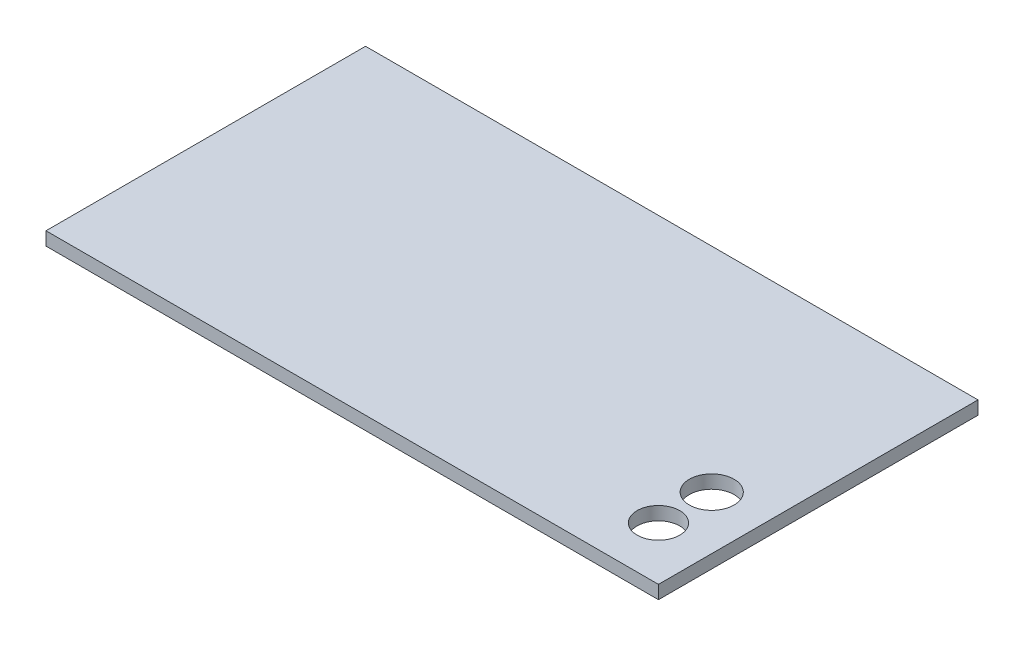
from build123d import *

# Parameters (mm, degrees)
SKETCH1_W           = 146.05
SKETCH1_H           = 76.2
SKETCH1_R           = 5.08
SKETCH1_R_2         = 5.334
BOSS_EXTRUDE1_DEPTH = 3.175


with BuildPart() as part:
    # Sketch1 → Boss-Extrude1 (new body)
    with BuildSketch(Plane(origin=(0, 0, 0), x_dir=(1, 0, 0), z_dir=(0, 1, 0))):
        with Locations((73.025, 38.1)):
            Rectangle(SKETCH1_W, SKETCH1_H)
        with Locations((133.35, 12.7)):
            Circle(SKETCH1_R, mode=Mode.SUBTRACT)
        with Locations((133.35, 25.4)):
            Circle(SKETCH1_R_2, mode=Mode.SUBTRACT)
    extrude(amount=BOSS_EXTRUDE1_DEPTH)


solid = part.part
